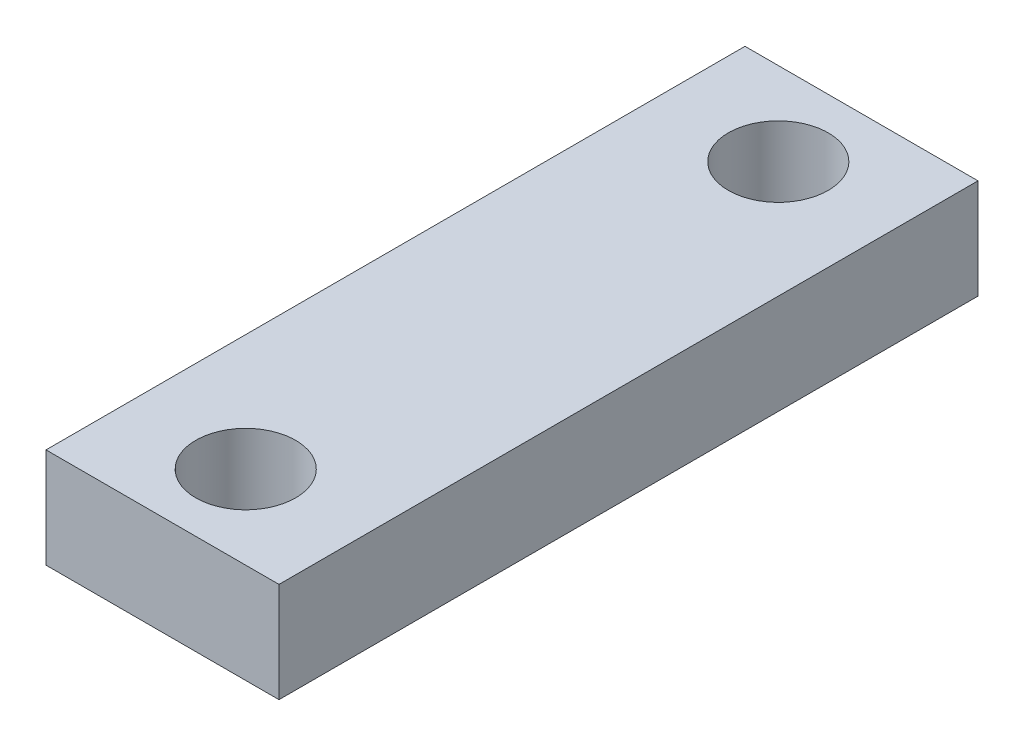
from build123d import *

# Parameters (mm, degrees)
SKETCH1_W           = 14
SKETCH1_H           = 42
SKETCH1_R           = 3
BOSS_EXTRUDE1_DEPTH = 6


with BuildPart() as part:
    # Sketch1 → Boss-Extrude1 (new body)
    with BuildSketch(Plane(origin=(0, 0, 0), x_dir=(1, 0, 0), z_dir=(0, 1, 0))):
        Rectangle(SKETCH1_W, SKETCH1_H)
        with Locations((0, 16)):
            Circle(SKETCH1_R, mode=Mode.SUBTRACT)
        with Locations((0, -16)):
            Circle(SKETCH1_R, mode=Mode.SUBTRACT)
    extrude(amount=BOSS_EXTRUDE1_DEPTH)


solid = part.part
